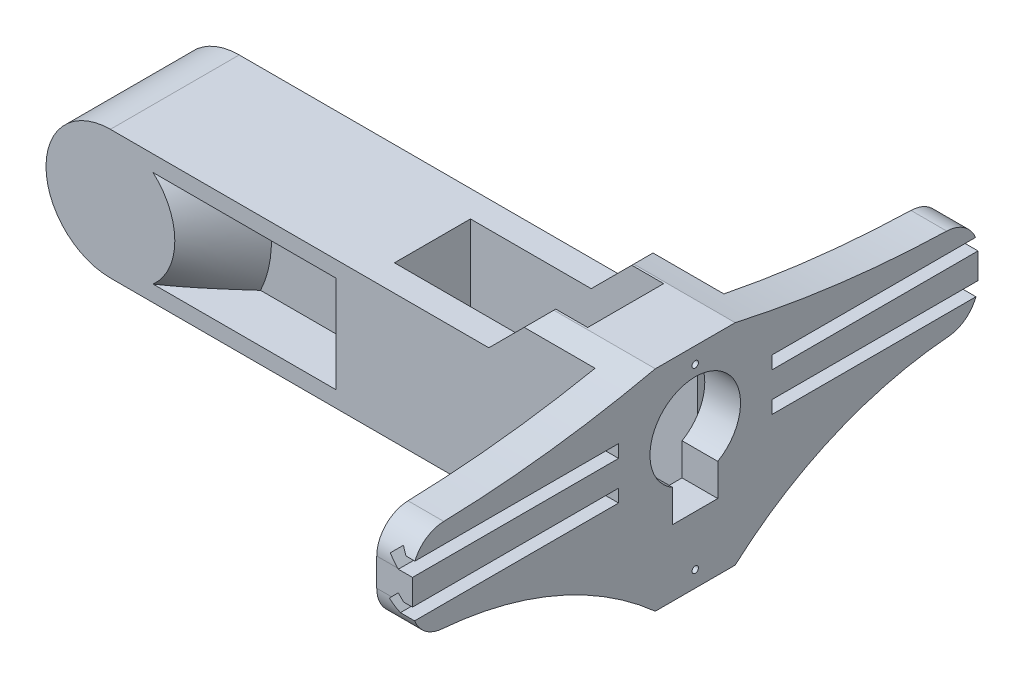
from build123d import *

# Parameters (mm, degrees)
SKETCH1_R                = 2
BOSS_EXTRUDE3_DEPTH      = 7
SKETCH3_R                = 1.0000000000000002
SKETCH3_R_2              = 0.9999999999999998
SKETCH3_R_3              = 0.9999999999999996
SKETCH3_R_4              = 0.9999999999999993
CUT_EXTRUDE2_DEPTH       = 26.09227496303999
BOSS_EXTRUDE4_START      = -7
BOSS_EXTRUDE4_DEPTH      = 7
BOSS_EXTRUDE5_START      = -30
BOSS_EXTRUDE5_DEPTH      = 30
FILLET2_R                = 1.5
CUT_EXTRUDE5_DEPTH       = 42.36510924463761
BOSS_EXTRUDE6_DEPTH      = 10.5
MOVE_START               = -28.7
MOVE_FACE1_DEPTH         = 5.7
DELETEFACE1_START        = 23.7
DELETEFACE1_OUTLINE_W    = 10.499999999999998
DELETEFACE1_OUTLINE_H    = 35.699999999999996
DELETEFACE1_DEPTH        = 15.7
SKETCH11_OUTSIDE_W       = 51.876
SKETCH11_OUTSIDE_H       = 42.462
CUT_EXTRUDE6_DEPTH       = 46.16926949380307
SERVO_START              = -12.760864102
SERVO_MICRO_OUTLINE_W    = 22.6
SERVO_MICRO_OUTLINE_H    = 12.399999999999999
SERVO_MICRO_DEPTH        = 22.3
SERVO_START_2            = 9.539135898
SERVO_MICRO_2_DEPTH      = 4.3
SERVO_START_3            = 2.889135898
SERVO_MICRO_3_DEPTH      = 2.4
SERVO_START_4            = 13.839135898
SERVO_MICRO_4_OUTLINE_R  = 2.5
SERVO_MICRO_4_DEPTH      = 3.3
SERVO_START_5            = -25.667487826
SERVO_MICRO_5_OUTLINE_R  = 0.6
SERVO_MICRO_5_DEPTH      = 2.3
SERVO_MICRO_6_OUTLINE_R  = 0.6
SERVO_MICRO_6_DEPTH      = 2.3
SERVO_MICRO_7_OUTLINE_R  = 0.6
SERVO_MICRO_7_DEPTH      = 2.3
BODY_MOVE_COPY1_ANGLE    = 90
SKETCH13_R               = 0.5000000000000009
SKETCH13_W               = 12.399999999999997
SKETCH13_H               = 4.17
SKETCH13_H_2             = 4.160545319150279
BOSS_EXTRUDE7_DEPTH      = 5.55
SKETCH13_3_W             = 12.399999999999997
SKETCH13_3_H             = 4.17
SKETCH13_3_R             = 0.5000000000000009
SKETCH13_3_H_2           = 4.160545319150279
BOSS_EXTRUDE8_DEPTH      = 10.8
CUT_EXTRUDE7_DEPTH       = 32
BOSS_EXTRUDE9_DEPTH      = 5.55
CUT_EXTRUDE8_DEPTH       = 72.0125468998838
BOSS_EXTRUDE10_DEPTH     = 5.55
FILLET4_R                = 5
CUT_EXTRUDE10_DEPTH      = 72.01254695034633
FILLET9_R                = 1
CUT_EXTRUDE12_DEPTH      = 69.37995941638475
CUT_EXTRUDE12_DEPTH_BACK = 69.37995941638475
BOSS_EXTRUDE11_DEPTH     = 70
BOSS_EXTRUDE12_REACH     = 82.196
SKETCH24_R               = 9.99999999999995
CHAMFER1_SIZE            = 7.5
SKETCH25_R               = 3.7999999999999967
CUT_EXTRUDE13_DEPTH      = 5
CUT_EXTRUDE14_DEPTH      = 30
BOSS_EXTRUDE13_DEPTH     = 9.999999999999996
BOSS_EXTRUDE14_DEPTH     = 25.25
SKETCH30_W               = 20
SKETCH30_H               = 14.999999999999993
BOSS_EXTRUDE15_DEPTH     = 5
CHAMFER2_START           = -5.424363199
CHAMFER2_DEPTH           = 4.330127019
CHAMFER3_START           = -5.429821862
CHAMFER3_DEPTH           = 4.330127019
CHAMFER4_START           = -22.981270045
CHAMFER4_DEPTH           = 4.330127019
CHAMFER5_START           = -22.975811382
CHAMFER5_DEPTH           = 4.330127018
CHAMFER6_SIZE            = 6.5


with BuildPart() as part:
    # Sketch1 → Boss-Extrude3 (new body)
    with BuildSketch(Plane.XY):
        with BuildLine():
            Line((5.606455718863049, 13.824363162033857), (-15.462379801128069, 15.791841653866829))
            Line((-15.462379801128069, 15.791841653866829), (-15.46237980112806, -15.791841653866806))
            Line((-15.46237980112806, -15.791841653866806), (5.606455718863063, -13.824363162033817))
            ThreePointArc((5.606455718863063, -13.824363162033817), (18.200000000000003, 2.613e-14), (5.606455718863049, 13.824363162033857))
        make_face()
        Circle(SKETCH1_R, mode=Mode.SUBTRACT)
    extrude(amount=BOSS_EXTRUDE3_DEPTH)

    # Sketch3 → Cut-Extrude2 (cut, through all)
    with BuildSketch(Plane.XY.offset(7)):
        with Locations((-4.5, 0)):
            Circle(SKETCH3_R)
        with Locations((-8.499999999999998, 0)):
            Circle(SKETCH3_R_2)
        with Locations(Location((4.5, -1.73e-15, 0), (0, 0, 180))):
            Circle(SKETCH3_R_3)
        with Locations(Location((8.499999999999998, -1.73e-15, 0), (0, 0, 180))):
            Circle(SKETCH3_R_4)
    extrude(amount=-CUT_EXTRUDE2_DEPTH, mode=Mode.SUBTRACT)

    # Sketch6 → Boss-Extrude4 (add)
    with BuildSketch(Plane.XY.offset(7).offset(BOSS_EXTRUDE4_START)):
        with BuildLine():
            Line((12.20372638619735, 13.208287910486863), (5.606455718863047, 13.824363162033858))
            ThreePointArc((5.606455718863047, 13.82436316203386), (18.2, 2.598e-14), (5.606455718863056, -13.824363162033816))
            Line((5.606455718863056, -13.824363162033816), (12.203726386197348, -13.208287910486817))
            ThreePointArc((12.203726386197348, -13.208287910486817), (19.699999999999996, 2.132e-14), (12.20372638619735, 13.20828791048686))
        make_face()
    extrude(amount=BOSS_EXTRUDE4_DEPTH)

    # Sketch6<3> → Boss-Extrude5 (add)
    with BuildSketch(Plane.XY.offset(7).offset(BOSS_EXTRUDE5_START)):
        with BuildLine():
            Line((23.700000000000006, 12.13472734042489), (12.20372638619735, 13.208287910486863))
            ThreePointArc((12.20372638619735, 13.20828791048686), (19.699999999999996, 2.132e-14), (12.203726386197348, -13.208287910486817))
            Line((12.203726386197348, -13.208287910486817), (23.700000000000003, -12.134727340424835))
            Line((23.700000000000003, -12.134727340424835), (23.700000000000006, 12.134727340424892))
        make_face()
    extrude(amount=BOSS_EXTRUDE5_DEPTH)

    # Fillet2
    fillet2_edges = [part.edges().sort_by_distance(p)[0] for p in [
        (12.20372638619735, -13.208287910486817, -11.5),
        (12.20372638619735, 13.208287910486861, -11.5),
    ]]
    fillet(fillet2_edges, radius=FILLET2_R)

    # Sketch8 → Cut-Extrude5 (cut, through all)
    with BuildSketch(Plane.XY.offset(7)):
        with BuildLine():
            Line((-15.462379801128069, 15.791841653866829), (-15.46237980112806, -15.791841653866808))
            Line((-15.46237980112806, -15.791841653866806), (1.328273056892355, -14.223874201150027))
            ThreePointArc((1.3282730568923518, -14.22387420115002), (-14.285758873920813, 0), (1.3282730568923529, 14.22387420115002))
            Line((1.3282730568923604, 14.223874201150062), (-15.462379801128069, 15.791841653866829))
        make_face()
    extrude(amount=-CUT_EXTRUDE5_DEPTH, mode=Mode.SUBTRACT)

    # Sketch10 → Boss-Extrude6 (add)
    with BuildSketch(Plane.ZX.offset(1.6347273404248903)):
        Polygon((7, 23.700000000000003), (7, 39.40000000018666), (-28.700000000000003, 39.40000000018665), (-28.700000000000014, 23.700000000000003), align=None)
    extrude(amount=BOSS_EXTRUDE6_DEPTH)

    # Move Face1: read off the stored shape, not the designer's step
    # Move Face1 outline → Move Face1 (add)
    with BuildSketch(Plane.XY.offset(MOVE_START)):
        with BuildLine():
            Line((17.033263706, -12.757289525), (23.7, -12.13472734))
            Line((23.7, -12.13472734), (23.7, 12.13472734))
            Line((23.7, 12.13472734), (17.033263706, 12.757289525))
            ThreePointArc((17.033263706, 12.757289525), (15.554272674, 11.938827155), (15.776353621, 10.263125757))
            ThreePointArc((15.776353621, 10.263125757), (19.7, 0), (15.776353621, -10.263125757))
            ThreePointArc((15.776353621, -10.263125757), (15.554272674, -11.938827155), (17.033263706, -12.757289525))
        make_face()
    extrude(amount=MOVE_FACE1_DEPTH)

    # DeleteFace1: read off the stored shape, not the designer's step
    # DeleteFace1 outline → DeleteFace1 (cut)
    with BuildSketch(Plane.YZ.offset(DELETEFACE1_START)):
        with Locations((6.884727339999999, -10.849999999999998)):
            Rectangle(DELETEFACE1_OUTLINE_W, DELETEFACE1_OUTLINE_H)
    extrude(amount=DELETEFACE1_DEPTH, mode=Mode.SUBTRACT)

    # Sketch11 outside → Cut-Extrude6 (cut, through all)
    with BuildSketch(Plane.XY.offset(7)):
        with Locations((4.706999999999997, 0)):
            Rectangle(SKETCH11_OUTSIDE_W, SKETCH11_OUTSIDE_H)
        with BuildLine():
            Line((23.700000000000003, 12.134727340424888), (-1.43e-15, 12.134727340424885))
            ThreePointArc((-1.43e-15, 12.134727340424885), (-12.134727340424885, 1.49e-15), (0, -12.134727340424885))
            Line((0, -12.134727340424885), (23.700000000000006, -12.134727340424835))
            Line((23.700000000000006, -12.134727340424835), (23.700000000000003, 12.134727340424888))
        make_face(mode=Mode.SUBTRACT)
    extrude(amount=-CUT_EXTRUDE6_DEPTH, mode=Mode.SUBTRACT)

    # Sketch13 → Boss-Extrude7 (add)
    # profile 1 of 3: a face of its own
    with BuildSketch(Plane(origin=(23.700000000000003, -3.39e-15, 0), x_dir=(0, 0, -1), z_dir=(1, -1.4e-16, 0))):
        Polygon((-9.000000000000002, -16.295272659575108), (-9.000000000000002, -12.134727340424831), (-7, -12.134727340424831), (-6.999999999999999, 12.134727340424892), (-9.000000000000002, 12.13472734042489), (-9.000000000000002, 16.30472734042489), (-21.4, 16.30472734042489), (-21.4, 12.13472734042489), (-59.100000000000016, 12.134727340424885), (-59.100000000000016, -12.134727340424831), (-21.4, -12.134727340424831), (-21.4, -16.295272659575108), align=None)
        with Locations(Location((-15.200000000000001, 13.80472734042489, 0), (0, 0, 90))):
            Circle(SKETCH13_R, mode=Mode.SUBTRACT)
        with Locations(Location((-15.200000000000001, -13.79527265957511, 0), (0, 0, 90))):
            Circle(SKETCH13_R, mode=Mode.SUBTRACT)
        with BuildLine():
            ThreePointArc((-11.700000000000001, -0.9920668991734916), (-15.199999999999998, 12.13472734042489), (-18.700000000000003, -0.9920668991734924))
            Line((-18.700000000000003, -0.9920668991734924), (-18.700000000000003, -5.9920668991734924))
            Line((-18.700000000000003, -5.9920668991734924), (-11.700000000000003, -5.992066899173492))
            Line((-11.700000000000003, -5.992066899173492), (-11.700000000000001, -0.9920668991734916))
        make_face(mode=Mode.SUBTRACT)
    # profile 2 of 3: a face of its own
    with BuildSketch(Plane(origin=(23.700000000000003, -3.39e-15, 0), x_dir=(0, 0, -1), z_dir=(1, -1.4e-16, 0))):
        with Locations((-15.2, 14.219727340424889)):
            Rectangle(SKETCH13_W, SKETCH13_H)
        with Locations(Location((-15.200000000000001, 13.80472734042489, 0), (0, 0, 90))):
            Circle(SKETCH13_R, mode=Mode.SUBTRACT)
    # profile 3 of 3: a face of its own
    with BuildSketch(Plane(origin=(23.700000000000003, -3.39e-15, 0), x_dir=(0, 0, -1), z_dir=(1, -1.4e-16, 0))):
        with Locations((-15.2, -14.214999999999968)):
            Rectangle(SKETCH13_W, SKETCH13_H_2)
        with Locations(Location((-15.200000000000001, -13.79527265957511, 0), (0, 0, 90))):
            Circle(SKETCH13_R, mode=Mode.SUBTRACT)
    extrude(amount=-BOSS_EXTRUDE7_DEPTH)

    # Sketch13<3> → Boss-Extrude8 (add)
    # profile 1 of 2: a face of its own
    with BuildSketch(Plane(origin=(23.700000000000003, -3.39e-15, 0), x_dir=(0, 0, -1), z_dir=(1, -1.4e-16, 0))):
        with Locations((-15.2, 14.219727340424889)):
            Rectangle(SKETCH13_3_W, SKETCH13_3_H)
        with Locations(Location((-15.200000000000001, 13.80472734042489, 0), (0, 0, 90))):
            Circle(SKETCH13_3_R, mode=Mode.SUBTRACT)
    # profile 2 of 2: a face of its own
    with BuildSketch(Plane(origin=(23.700000000000003, -3.39e-15, 0), x_dir=(0, 0, -1), z_dir=(1, -1.4e-16, 0))):
        with Locations((-15.2, -14.214999999999968)):
            Rectangle(SKETCH13_3_W, SKETCH13_3_H_2)
        with Locations(Location((-15.200000000000001, -13.79527265957511, 0), (0, 0, 90))):
            Circle(SKETCH13_3_R, mode=Mode.SUBTRACT)
    extrude(amount=-BOSS_EXTRUDE8_DEPTH)

    # Sketch15 → Cut-Extrude7 (cut)
    with BuildSketch(Plane(origin=(1.903e-14, 0, -28.70000000000003), x_dir=(-1, 0, -6.6e-16), z_dir=(6.6e-16, 0, -1))):
        Polygon((-22.328427124746177, 3.104727340424887), (-23.699999999999985, 3.104727340424887), (-23.699999999999985, 1.1047273404248876), (-21.499999999999986, 1.1047273404248876), (-20.08578643762689, 2.5189409027979854), (-21.49999999999999, 3.9331544651710773), align=None)
        Polygon((-22.328427124746177, 9.104727340424887), (-23.699999999999985, 9.104727340424887), (-23.699999999999985, 7.104727340424887), (-21.499999999999986, 7.104727340424887), (-20.08578643762689, 8.518940902797986), (-21.49999999999999, 9.933154465171077), align=None)
    cut_extrude7 = extrude(amount=-CUT_EXTRUDE7_DEPTH, mode=Mode.SUBTRACT)

    # Mirror1: Cut-Extrude7 across plane
    add(cut_extrude7.mirror(Plane(origin=(0, 0, 15.200000000000001), x_dir=(1, 0, 0), z_dir=(0, 0, -1))), mode=Mode.SUBTRACT)

    # Sketch16 → Boss-Extrude9 (add)
    with BuildSketch(Plane(origin=(23.700000000000003, -3.39e-15, 0), x_dir=(0, 0, -1), z_dir=(1, -1.4e-16, 0))):
        with BuildLine():
            Line((-21.4, 12.13472734042489), (-21.4, 16.30472734042489))
            ThreePointArc((-21.4, 16.30472734042489), (-40.135039546574305, 13.18039662240372), (-59.100000000000016, 12.134727340424885))
            Line((-59.100000000000016, 12.134727340424885), (-21.4, 12.13472734042489))
        make_face()
        with BuildLine():
            Line((-9.000000000000002, 16.30472734042489), (-9.000000000000002, 12.13472734042489))
            Line((-9.000000000000002, 12.13472734042489), (28.700000000000014, 12.134727340424892))
            ThreePointArc((28.700000000000014, 12.134727340424892), (9.735039546574328, 13.180396622403777), (-9.000000000000002, 16.30472734042489))
        make_face()
    extrude(amount=-BOSS_EXTRUDE9_DEPTH)

    # Sketch18 → Cut-Extrude8 (cut, through all)
    with BuildSketch(Plane(origin=(23.700000000000003, -3.39e-15, 0), x_dir=(0, 0, -1), z_dir=(1, -1.4e-16, 0))):
        with BuildLine():
            Line((-59.100000000000016, -12.134727340424831), (-26.661429094135563, -12.134727340424831))
            ThreePointArc((-26.661429094135563, -12.134727340424838), (-42.096369157624615, -4.537893974213425), (-59.100000000000016, -1.9252726595751))
            Line((-59.100000000000016, -1.9252726595751037), (-59.100000000000016, -12.134727340424831))
        make_face()
        with BuildLine():
            Line((-3.7385709058644423, -12.134727340424831), (28.700000000000003, -12.134727340424831))
            Line((28.700000000000003, -12.134727340424831), (28.700000000000003, -1.9252726595751037))
            ThreePointArc((28.700000000000003, -1.9252726595751), (11.69636915762461, -4.537893974213425), (-3.738570905864435, -12.134727340424838))
        make_face()
    extrude(amount=-CUT_EXTRUDE8_DEPTH, mode=Mode.SUBTRACT)

    # Sketch18<3> → Boss-Extrude10 (add)
    with BuildSketch(Plane(origin=(23.700000000000003, -3.39e-15, 0), x_dir=(0, 0, -1), z_dir=(1, -1.4e-16, 0))):
        with BuildLine():
            ThreePointArc((-26.661429094135563, -12.134727340424838), (-23.96906894889605, -14.137042924937433), (-21.4, -16.295272659575097))
            Line((-21.4, -16.295272659575108), (-21.4, -12.134727340424831))
            Line((-21.4, -12.134727340424831), (-26.66142909413556, -12.134727340424831))
        make_face()
        with BuildLine():
            ThreePointArc((-9, -16.295272659575097), (-6.430931051103947, -14.137042924937433), (-3.738570905864435, -12.134727340424838))
            Line((-3.7385709058644423, -12.134727340424831), (-9.000000000000005, -12.134727340424831))
            Line((-9.000000000000005, -12.134727340424831), (-9.000000000000005, -16.295272659575108))
        make_face()
    extrude(amount=-BOSS_EXTRUDE10_DEPTH)

    # Fillet4
    fillet4_edges = [part.edges().sort_by_distance(p)[0] for p in [
        (21.63952842596371, -1.9252726595751048, -28.700000000000003),
        (20.925, -1.925272659575101, 59.10000000000002),
        (20.925000000000004, 12.134727340424881, 59.100000000000016),
    ]]
    fillet(fillet4_edges, radius=FILLET4_R)

    # Sketch19 → Cut-Extrude10 (cut, through all)
    with BuildSketch(Plane(origin=(23.700000000000003, -3.39e-15, 0), x_dir=(0, 0, -1), z_dir=(1, -1.4e-16, 0))):
        with BuildLine():
            Line((24.105591483628846, 12.321380196120076), (30.19974331893468, 12.321380196120076))
            Line((30.19974331893468, 12.321380196120076), (30.19974331893468, 7.512752922909521))
            Line((30.19974331893468, 7.512752922909521), (28.687547870024137, 7.690513778051795))
            ThreePointArc((28.687547870024137, 7.690513778051795), (28.58393863914358, 8.408905582685197), (28.37741082226619, 9.10472734042489))
            ThreePointArc((28.37741082226619, 9.10472734042489), (26.70764725474025, 11.33211091295099), (24.105591483628846, 12.321380196120076))
        make_face()
    extrude(amount=-CUT_EXTRUDE10_DEPTH, mode=Mode.SUBTRACT)

    # Fillet9
    fillet9_edges = [part.edges().sort_by_distance(p)[0] for p in [
        (18.150000000000002, 2.76e-14, 7),
    ]]
    fillet(fillet9_edges, radius=FILLET9_R)

    # Sketch22 → Cut-Extrude12 (cut, two sides: drawn at the far end of the back side and taken through both)
    with BuildSketch(Plane.ZY.offset(-18.15).offset(-CUT_EXTRUDE12_DEPTH_BACK)):
        Polygon((15.200000000000001, 13.80472734042489), (15.200000000000001, -21.5200756959896), (-43.4695777829905, 0), (-33.75098645134665, 32.930662038836886), (15.200000000000001, 22.945807930983616), align=None)
    extrude(amount=CUT_EXTRUDE12_DEPTH + CUT_EXTRUDE12_DEPTH_BACK, mode=Mode.SUBTRACT)

    # Mirror2: part across plane


with BuildPart() as body_2:
    # Servo Micro: read off the stored shape, not the designer's step
    # Servo Micro outline → Servo Micro (new body)
    with BuildSketch(Plane(origin=(0, 0, 0), x_dir=(1, 0, 0), z_dir=(0, 1, 0)).offset(SERVO_START)):
        with Locations((-12.067487826, -26.388081974)):
            Rectangle(SERVO_MICRO_OUTLINE_W, SERVO_MICRO_OUTLINE_H)
    extrude(amount=SERVO_MICRO_DEPTH)

    # Servo Micro 2 outline → Servo Micro 2 (add)
    with BuildSketch(Plane(origin=(0, 0, 0), x_dir=(1, 0, 0), z_dir=(0, 1, 0)).offset(SERVO_START_2)):
        with BuildLine():
            ThreePointArc((-11.10082116, -25.109193568), (-23.367487826, -26.388081974), (-11.10082116, -27.666970381))
            ThreePointArc((-11.10082116, -27.666970381), (-9.567487826, -26.388081975), (-11.10082116, -25.109193568))
        make_face()
    extrude(amount=SERVO_MICRO_2_DEPTH)

    # Servo Micro 3 outline → Servo Micro 3 (add)
    with BuildSketch(Plane(origin=(0, 0, 0), x_dir=(1, 0, 0), z_dir=(0, 1, 0)).offset(SERVO_START_3)):
        with BuildLine():
            Line((2.567676828, -25.838081974), (4.232512174, -25.838081974))
            Line((4.232512174, -25.838081974), (4.232512174, -20.188081974))
            Line((4.232512174, -20.188081974), (-0.767487826, -20.188081974))
            Line((-0.767487826, -20.188081974), (-0.767487826, -32.588081974))
            Line((-0.767487826, -32.588081974), (4.232512174, -32.588081974))
            Line((4.232512174, -32.588081974), (4.232512174, -26.938081974))
            Line((4.232512174, -26.938081974), (2.567676828, -26.938081974))
            ThreePointArc((2.567676828, -26.938081974), (0.732512174, -26.388081974), (2.567676828, -25.838081974))
        make_face()
        with BuildLine():
            Line((-23.367487826, -32.588081974), (-23.367487826, -20.188081974))
            Line((-23.367487826, -20.188081974), (-28.367487826, -20.188081974))
            Line((-28.367487826, -20.188081974), (-28.367487826, -25.838081974))
            Line((-28.367487826, -25.838081974), (-26.702652481, -25.838081974))
            ThreePointArc((-26.702652481, -25.838081974), (-24.867487826, -26.388081974), (-26.702652481, -26.938081974))
            Line((-26.702652481, -26.938081974), (-28.367487826, -26.938081974))
            Line((-28.367487826, -26.938081974), (-28.367487826, -32.588081974))
            Line((-28.367487826, -32.588081974), (-23.367487826, -32.588081974))
        make_face()
    extrude(amount=SERVO_MICRO_3_DEPTH)

    # Servo Micro 4 outline → Servo Micro 4 (add)
    with BuildSketch(Plane(origin=(0, 0, 0), x_dir=(1, 0, 0), z_dir=(0, 1, 0)).offset(SERVO_START_4)):
        with Locations((-17.167487826, -26.388081974)):
            Circle(SERVO_MICRO_4_OUTLINE_R)
    extrude(amount=SERVO_MICRO_4_DEPTH)


with BuildPart() as body_3:
    # Servo Micro 5 outline → Servo Micro 5 (new body)
    with BuildSketch(Plane.YZ.offset(SERVO_START_5)):
        with Locations((-8.260864102, 25.188081974)):
            Circle(SERVO_MICRO_5_OUTLINE_R)
    extrude(amount=SERVO_MICRO_5_DEPTH)


with BuildPart() as body_4:
    # Servo Micro 6 outline → Servo Micro 6 (new body)
    with BuildSketch(Plane.YZ.offset(SERVO_START_5)):
        with Locations((-8.260864102, 27.588081974)):
            Circle(SERVO_MICRO_6_OUTLINE_R)
    extrude(amount=SERVO_MICRO_6_DEPTH)


with BuildPart() as body_5:
    # Servo Micro 7 outline → Servo Micro 7 (new body)
    with BuildSketch(Plane.YZ.offset(SERVO_START_5)):
        with Locations((-8.260864102, 26.388081974)):
            Circle(SERVO_MICRO_7_OUTLINE_R)
    extrude(amount=SERVO_MICRO_7_DEPTH)


with BuildPart() as body_2_1:
    # Body-Move/Copy1: read off the stored shape, not the designer's step
    # Body-Move/Copy1: moved
    add(body_2.part.moved(Location((12.0627605, 7.6108641, -11.188082))).rotate(Axis((0, 0, 0), (0, 0, -1)), BODY_MOVE_COPY1_ANGLE))


with BuildPart() as part_1:
    add(part.part)
    add(part.part.mirror(Plane(origin=(23.700000000000014, 13.80472734042489, 15.200000000000001), x_dir=(1, 0, 0), z_dir=(0, 0, 1))))



with BuildPart() as body_2_2:
    # Sketch23 → Boss-Extrude11 (new body)
    with BuildSketch(Plane.ZY.offset(-12.9)):
        Polygon((5.200000000000005, -9.995272659575157), (25.200000000000006, -9.995272659575157), (25.200000000000006, -7.495272659575142), (17.700000000000006, -7.495272659575142), (17.700000000000006, 7.504727340424927), (25.200000000000006, 7.504727340424844), (25.200000000000006, 10.004727340424843), (5.200000000000005, 10.004727340424857), (5.200000000000003, 7.504727340424844), (12.700000000000001, 7.504727340424927), (12.700000000000001, -7.495272659575142), (5.200000000000003, -7.495272659575142), align=None)
    extrude(amount=BOSS_EXTRUDE11_DEPTH)

    # Boss-Extrude12: up to this face of the body (flat: up to its plane)
    boss_extrude12_end = Plane(body_2_2.part.faces().sort_by_distance((-22.1, 8.75472734, 5.2))[0])
    # Sketch24 → Boss-Extrude12 (add, up to the picked face)
    with BuildSketch(Plane.XY.offset(25.200000000000006), mode=Mode.PRIVATE) as boss_extrude12_sk1:
        with Locations((-57.10000000000001, 0.00472734042490132)):
            Circle(SKETCH24_R)
    boss_extrude12_tool1 = split(extrude(boss_extrude12_sk1.sketch, amount=-BOSS_EXTRUDE12_REACH, mode=Mode.PRIVATE), bisect_by=boss_extrude12_end, keep=Keep.BOTH, mode=Mode.PRIVATE)
    add(boss_extrude12_tool1.solids().sort_by(Axis((-57.1, 0.004727, 25.2), (0, 0, -1)))[0])

    # Chamfer1
    chamfer1_edges = [body_2_2.edges().sort_by_distance(p)[0] for p in [
        (-47.10000000000006, 0.00472734042485425, 12.700000000000001),
        (-47.10000000000006, 0.00472734042485425, 17.700000000000006),
    ]]
    chamfer(chamfer1_edges, length=CHAMFER1_SIZE - 0.0001)  # a hair under: the kernel refuses the full size

    # Sketch25 → Cut-Extrude13 (cut)
    with BuildSketch(Plane(origin=(0, -3.61e-15, 5.199999999999998), x_dir=(-1, 0, 0), z_dir=(0, 6.9e-16, -1))):
        with Locations(Location((57.10000000000001, 0.00472734042490493, 0), (0, 0, 90))):
            Circle(SKETCH25_R)
    extrude(amount=-CUT_EXTRUDE13_DEPTH, mode=Mode.SUBTRACT)

    # Sketch26 → Cut-Extrude14 (cut)
    with BuildSketch(Plane.ZY.offset(-12.9)):
        Polygon((9.30000000000001, 11.20472734042489), (21.1, 11.20472734042489), (21.10000000000001, -11.195272659575108), (9.300000000000006, -11.195272659575108), align=None)
    extrude(amount=CUT_EXTRUDE14_DEPTH, mode=Mode.SUBTRACT)


with BuildPart() as part_2:
    add(part_1.part)

    add(body_2_2.part)  # Boss-Extrude13 merges body 2 2
    # Sketch28 → Boss-Extrude13 (add)
    with BuildSketch(Plane.ZY.offset(-18.15)):
        with BuildLine():
            Line((9.300000000000006, -9.995272659575157), (9.300000000000006, 16.30472734042489))
            Line((9.300000000000006, 16.30472734042489), (9.000000000000002, 16.304727340424876))
            ThreePointArc((9.000000000000002, 16.304727340424876), (7.102269488512391, 15.890916990007383), (5.200000000000003, 15.498500255631015))
            Line((5.200000000000003, 15.498500255631015), (5.200000000000005, 10.004727340424857))
            Line((5.200000000000005, 10.004727340424857), (5.200000000000003, -13.190797577168684))
            ThreePointArc((5.200000000000003, -13.190797577168684), (7.133635614940346, -14.701863798460948), (9.000000000000002, -16.2952726595751))
            Line((9.000000000000002, -16.2952726595751), (9.300000000000006, -16.295272659575108))
            Line((9.300000000000006, -16.295272659575108), (9.300000000000006, -9.995272659575157))
        make_face()
        with BuildLine():
            Line((25.2, 10.004727340424857), (25.2, -13.190797577168684))
            ThreePointArc((25.2, -13.190797577168684), (23.26636438505966, -14.701863798460955), (21.4, -16.295272659575105))
            Line((21.4, -16.295272659575105), (21.099999999999998, -16.295272659575108))
            Line((21.099999999999998, -16.295272659575108), (21.099999999999998, -9.995272659575157))
            Line((21.099999999999998, -9.995272659575157), (21.099999999999998, 16.30472734042489))
            Line((21.099999999999998, 16.30472734042489), (21.4, 16.30472734042489))
            ThreePointArc((21.4, 16.30472734042489), (23.29773051148763, 15.890916990007383), (25.2, 15.498500255631015))
            Line((25.2, 15.498500255631015), (25.2, 10.004727340424857))
        make_face()
    extrude(amount=BOSS_EXTRUDE13_DEPTH)

    # Sketch29 → Boss-Extrude14 (add)
    with BuildSketch(Plane.ZY.offset(-8.150000000000004)):
        Polygon((9.300000000000006, -7.495272659575142), (9.300000000000006, 7.504727340424886), (5.2000000000000055, 7.504727340424852), (5.20000000000001, -7.495272659575134), align=None)
        Polygon((21.1, 7.504727340424889), (21.10000000000001, -7.495272659575142), (25.200000000000006, -7.495272659575142), (25.200000000000006, 7.504727340424844), align=None)
    extrude(amount=BOSS_EXTRUDE14_DEPTH)

    # Sketch30 → Boss-Extrude15 (add)
    with BuildSketch(Plane.ZY.offset(17.099999999999998)):
        with Locations((15.200000000000006, 0.0047273404248549)):
            Rectangle(SKETCH30_W, SKETCH30_H)
    extrude(amount=BOSS_EXTRUDE15_DEPTH)

    # Chamfer2: read off the stored shape, not the designer's step
    # Chamfer2 outline → Chamfer2 (add)
    with BuildSketch(Plane(origin=(0, 0, 0), x_dir=(0.8164965809277258, -0.40824829046386313, -0.40824829046386313), z_dir=(0.5773502691896258, 0.5773502691896258, 0.5773502691896258)).offset(CHAMFER2_START)):
        Polygon((-32.416844191, -3.673612528), (-23.231257656, -8.976913387), (-23.231257656, 1.629688331), align=None)
    extrude(amount=CHAMFER2_DEPTH)

    # Chamfer3: read off the stored shape, not the designer's step
    # Chamfer3 outline → Chamfer3 (add)
    with BuildSketch(Plane(origin=(0, 0, 0), x_dir=(0.8164965809277258, 0.40824829046386313, -0.40824829046386313), z_dir=(0.5773502691896258, -0.5773502691896258, 0.5773502691896258)).offset(CHAMFER3_START)):
        Polygon((-32.412984334, 3.680297997), (-23.227397799, -1.623002862), (-23.227397799, 8.983598856), align=None)
    extrude(amount=CHAMFER3_DEPTH)

    # Chamfer4: read off the stored shape, not the designer's step
    # Chamfer4 outline → Chamfer4 (add)
    with BuildSketch(Plane(origin=(0, 0, 0), x_dir=(0.8164965809277258, 0.40824829046386313, 0.40824829046386313), z_dir=(0.5773502691896258, -0.5773502691896258, -0.5773502691896258)).offset(CHAMFER4_START)):
        Polygon((-20.002236304, 17.815748151), (-10.816649769, 12.512447293), (-10.816649769, 23.11904901), align=None)
    extrude(amount=CHAMFER4_DEPTH)

    # Chamfer5: read off the stored shape, not the designer's step
    # Chamfer5 outline → Chamfer5 (add)
    with BuildSketch(Plane(origin=(0, 0, 0), x_dir=(0.8164965809277258, -0.40824829046386313, 0.40824829046386313), z_dir=(0.5773502691896258, 0.5773502691896258, -0.5773502691896258)).offset(CHAMFER5_START)):
        Polygon((-20.006096161, -17.82243362), (-10.820509626, -23.125734479), (-10.820509626, -12.519132761), align=None)
    extrude(amount=CHAMFER5_DEPTH)

    # Chamfer6
    # the kernel refuses this chamfer: 6.5 mm, written as the material it adds along each edge
    with BuildSketch(Plane(origin=(8.15, -9.995272659575159, 25.200000000000003), x_dir=(0, -1, 0), z_dir=(0, 0, -1))) as chamfer6_piece_1_section:
        Polygon((CHAMFER6_SIZE, 0), (-1.78e-15, CHAMFER6_SIZE), (0, 0), align=None)
    chamfer6_piece_1 = extrude(amount=4.100000000000005, mode=Mode.PRIVATE)
    chamfer6_piece_1 = chamfer6_piece_1 - Plane(origin=(8.149999999999993, -58.563647746559155, 59.09999999999775), x_dir=(0, 0.801097314315752, -0.5985341201603207), z_dir=(1, -1.4e-16, 0)) * Cylinder(56.638375086983245, 35, mode=Mode.PRIVATE)
    chamfer6_piece_1 = split(chamfer6_piece_1, bisect_by=Plane(origin=(8.149999999999999, -16.295272659575065, 25.200000000000077), z_dir=(1.4e-16, 1, -1.184e-14)), keep=Keep.TOP, mode=Mode.PRIVATE)
    add(chamfer6_piece_1)
    with BuildSketch(Plane(origin=(8.15, -9.995272659575159, 25.200000000000003), x_dir=(0, -1, 0), z_dir=(0, 0, -1))) as chamfer6_piece_2_section:
        Polygon((CHAMFER6_SIZE, 0), (-1.78e-15, CHAMFER6_SIZE), (0, 0), align=None)
    chamfer6_piece_2 = extrude(amount=20.815939421778424, mode=Mode.PRIVATE)
    chamfer6_piece_2 = split(chamfer6_piece_2, bisect_by=Plane(origin=(8.149999999999999, -16.295272659575062, 25.200000000000077), z_dir=(1.4e-16, 1, -1.184e-14)), keep=Keep.TOP, mode=Mode.PRIVATE)
    chamfer6_piece_2 = split(chamfer6_piece_2, bisect_by=Plane(origin=(8.15, -9.995272659575145, 5.199999999999989), z_dir=(0, -7.1e-16, 1)), keep=Keep.TOP, mode=Mode.PRIVATE)
    chamfer6_piece_2 = split(chamfer6_piece_2, bisect_by=Plane(origin=(8.15, -9.995272659575157, 9.300000000000006), z_dir=(0, 1.6e-16, -1)), keep=Keep.TOP, mode=Mode.PRIVATE)
    chamfer6_piece_2 = chamfer6_piece_2 - Plane(origin=(8.149999999999993, -58.563647746554366, -28.699999999993807), x_dir=(0, 0.801097314315755, 0.5985341201603167), z_dir=(1, -1.4e-16, 0)) * Cylinder(56.63837508697705, 68, mode=Mode.PRIVATE)
    add(chamfer6_piece_2)
    with BuildSketch(Plane(origin=(8.15, -9.995272659575159, 5.200000000000005), x_dir=(-1, 2.7e-16, 0), z_dir=(0, 0, 1))) as chamfer6_piece_3_section:
        Polygon((CHAMFER6_SIZE, 0), (-1.78e-15, CHAMFER6_SIZE), (0, 0), align=None)
    chamfer6_piece_3 = extrude(amount=4.100000000000001, mode=Mode.PRIVATE)
    chamfer6_piece_3 = split(chamfer6_piece_3, bisect_by=Plane(origin=(8.149999999999999, -16.2952726595753, 5.200000000000079), z_dir=(1.4e-16, 1, -1.184e-14)), keep=Keep.TOP, mode=Mode.PRIVATE)
    chamfer6_piece_3 = chamfer6_piece_3 - Plane(origin=(8.149999999999993, -58.563647746554366, -28.699999999993807), x_dir=(0, 0.801097314315755, 0.5985341201603167), z_dir=(1, -1.4e-16, 0)) * Cylinder(56.63837508697705, 35, mode=Mode.PRIVATE)
    add(chamfer6_piece_3)
    with BuildSketch(Plane(origin=(8.15, -9.995272659575159, 5.200000000000005), x_dir=(-1, 2.7e-16, 0), z_dir=(0, 0, 1))) as chamfer6_piece_4_section:
        Polygon((CHAMFER6_SIZE, 0), (-1.78e-15, CHAMFER6_SIZE), (0, 0), align=None)
    chamfer6_piece_4 = extrude(amount=20.815939421778424, mode=Mode.PRIVATE)
    chamfer6_piece_4 = split(chamfer6_piece_4, bisect_by=Plane(origin=(8.15, -9.995272659575159, 25.200000000000003), z_dir=(0, 0, -1)), keep=Keep.TOP, mode=Mode.PRIVATE)
    chamfer6_piece_4 = chamfer6_piece_4 - Plane(origin=(8.149999999999993, -58.563647746559155, 59.09999999999775), x_dir=(0, 0.801097314315752, -0.5985341201603207), z_dir=(1, -1.4e-16, 0)) * Cylinder(56.638375086983245, 68, mode=Mode.PRIVATE)
    chamfer6_piece_4 = split(chamfer6_piece_4, bisect_by=Plane(origin=(8.15, -9.995272659575154, 21.10000000000001), z_dir=(0, 3.2e-16, 1)), keep=Keep.TOP, mode=Mode.PRIVATE)
    chamfer6_piece_4 = split(chamfer6_piece_4, bisect_by=Plane(origin=(8.149999999999999, -16.295272659575303, 5.200000000000079), z_dir=(1.4e-16, 1, -1.184e-14)), keep=Keep.TOP, mode=Mode.PRIVATE)
    add(chamfer6_piece_4)
    with BuildSketch(Plane(origin=(8.150000000000004, 10.004727340424857, 4.384060578221579), x_dir=(-1, 2.7e-16, 0), z_dir=(0, -7.1e-16, 1))) as chamfer6_piece_5_section:
        Polygon((CHAMFER6_SIZE, 0), (1.78e-15, -CHAMFER6_SIZE), (0, 0), align=None)
    chamfer6_piece_5 = extrude(amount=20.815939421778424, mode=Mode.PRIVATE)
    chamfer6_piece_5 = split(chamfer6_piece_5, bisect_by=Plane(origin=(8.150000000000004, 10.004727340424857, 9.30000000000001), z_dir=(0, 1.6e-16, -1)), keep=Keep.TOP, mode=Mode.PRIVATE)
    chamfer6_piece_5 = split(chamfer6_piece_5, bisect_by=Plane(origin=(8.150000000000004, 10.004727340424857, 5.200000000000005), z_dir=(0, -7.1e-16, 1)), keep=Keep.TOP, mode=Mode.PRIVATE)
    chamfer6_piece_5 = split(chamfer6_piece_5, bisect_by=Plane(origin=(8.150000000000006, 16.304727340424886, 4.384060578221579), z_dir=(-1.4e-16, -1, 0)), keep=Keep.TOP, mode=Mode.PRIVATE)
    chamfer6_piece_5 = chamfer6_piece_5 - Plane(origin=(8.150000000000029, 184.63819256829515, -28.700000000011105), x_dir=(0, -0.975826572559034, 0.21854633441832977), z_dir=(1, -1.4e-16, 0)) * Cylinder(172.50346522787143, 68, mode=Mode.PRIVATE)
    add(chamfer6_piece_5)
    with BuildSketch(Plane(origin=(8.150000000000004, 10.004727340424845, 21.099999999999998), x_dir=(-1, 2.7e-16, 0), z_dir=(0, -7.1e-16, 1))) as chamfer6_piece_6_section:
        Polygon((CHAMFER6_SIZE, 0), (1.78e-15, -CHAMFER6_SIZE), (0, 0), align=None)
    chamfer6_piece_6 = extrude(amount=4.100000000000005, mode=Mode.PRIVATE)
    chamfer6_piece_6 = split(chamfer6_piece_6, bisect_by=Plane(origin=(8.150000000000006, 16.304727340424886, 21.099999999999998), z_dir=(-1.4e-16, -1, 0)), keep=Keep.TOP, mode=Mode.PRIVATE)
    chamfer6_piece_6 = chamfer6_piece_6 - Plane(origin=(8.150000000000029, 184.63819256775145, 59.099999999896355), x_dir=(0, -0.9758265725590253, -0.21854633441836852), z_dir=(1, -1.4e-16, 0)) * Cylinder(172.5034652273158, 35, mode=Mode.PRIVATE)
    add(chamfer6_piece_6)
    with BuildSketch(Plane(origin=(8.150000000000004, 10.00472734042484, 26.015939421778427), x_dir=(-1, 2.7e-16, 0), z_dir=(0, 7.1e-16, -1))) as chamfer6_piece_7_section:
        Polygon((CHAMFER6_SIZE, 0), (1.78e-15, CHAMFER6_SIZE), (0, 0), align=None)
    chamfer6_piece_7 = extrude(amount=20.81593942177842, mode=Mode.PRIVATE)
    chamfer6_piece_7 = split(chamfer6_piece_7, bisect_by=Plane(origin=(8.150000000000004, 10.00472734042484, 25.200000000000006), z_dir=(0, 0, -1)), keep=Keep.TOP, mode=Mode.PRIVATE)
    chamfer6_piece_7 = split(chamfer6_piece_7, bisect_by=Plane(origin=(8.150000000000004, 10.004727340424838, 21.1), z_dir=(0, 3.2e-16, 1)), keep=Keep.TOP, mode=Mode.PRIVATE)
    chamfer6_piece_7 = split(chamfer6_piece_7, bisect_by=Plane(origin=(8.150000000000006, 16.304727340424886, 26.015939421778427), z_dir=(-1.4e-16, -1, 0)), keep=Keep.TOP, mode=Mode.PRIVATE)
    chamfer6_piece_7 = chamfer6_piece_7 - Plane(origin=(8.150000000000029, 184.63819256775145, 59.099999999896355), x_dir=(0, -0.9758265725590253, -0.21854633441836852), z_dir=(1, -1.4e-16, 0)) * Cylinder(172.5034652273158, 68, mode=Mode.PRIVATE)
    add(chamfer6_piece_7)
    with BuildSketch(Plane(origin=(8.150000000000004, 10.004727340424852, 9.300000000000006), x_dir=(-1, 2.7e-16, 0), z_dir=(0, 7.1e-16, -1))) as chamfer6_piece_8_section:
        Polygon((CHAMFER6_SIZE, 0), (1.78e-15, CHAMFER6_SIZE), (0, 0), align=None)
    chamfer6_piece_8 = extrude(amount=4.1, mode=Mode.PRIVATE)
    chamfer6_piece_8 = split(chamfer6_piece_8, bisect_by=Plane(origin=(8.150000000000006, 16.304727340424886, 9.300000000000006), z_dir=(-1.4e-16, -1, 0)), keep=Keep.TOP, mode=Mode.PRIVATE)
    chamfer6_piece_8 = chamfer6_piece_8 - Plane(origin=(8.150000000000029, 184.63819256829515, -28.700000000011105), x_dir=(0, -0.975826572559034, 0.21854633441832977), z_dir=(1, -1.4e-16, 0)) * Cylinder(172.50346522787143, 35, mode=Mode.PRIVATE)
    add(chamfer6_piece_8)


solid = part_2.part
